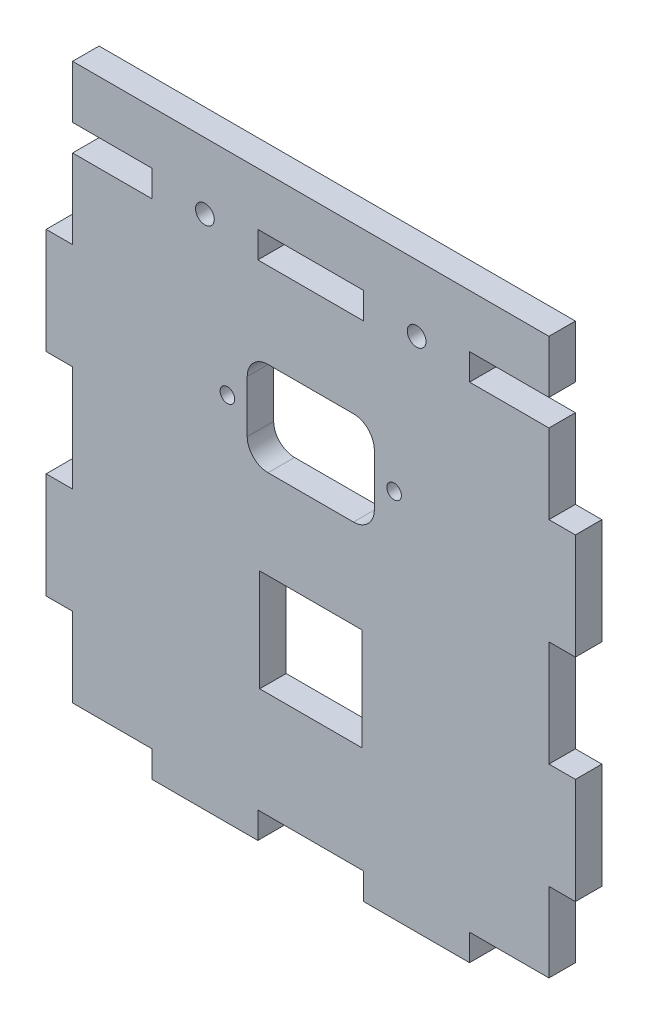
from build123d import *

# Parameters (mm, degrees)
SKETCH1_W                 = 127
SKETCH1_H                 = 139.7
BOSS_EXTRUDE1_DEPTH       = 6.35
SKETCH5_W                 = 6.35
SKETCH5_H                 = 25.4
CUT_EXTRUDE4_DEPTH        = 6.35
SKETCH6_W                 = 25.4
SKETCH6_H                 = 6.35
CUT_EXTRUDE5_DEPTH        = 6.35
LPATTERN5_COUNT           = 3
LPATTERN5_PITCH           = 50.8
LPATTERN5_COUNT_DIR2      = 2
LPATTERN5_PITCH_DIR2      = 120.65
LPATTERN6_COUNT           = 3
LPATTERN6_PITCH           = 50.8
LPATTERN6_COUNT_DIR2      = 2
LPATTERN6_PITCH_DIR2      = 120.65
SKETCH7_W                 = 6.35
SKETCH7_H                 = 19.05
SKETCH7_H_2               = 12.7
CUT_EXTRUDE6_DEPTH        = 6.35
F_8_CLEARANCE_HOLE1_D     = 4.4958
F_8_CLEARANCE_HOLE1_DEPTH = 10.16
F_8_CLEARANCE_HOLE1_TIP   = 1.350674586
SKETCH12_R                = 1.75
CUT_EXTRUDE9_DEPTH        = 6.35
SKETCH13_W                = 24.5
SKETCH13_H                = 24.5
CUT_EXTRUDE10_DEPTH       = 6.35


with BuildPart() as part:
    # Sketch1 → Boss-Extrude1 (new body)
    with BuildSketch(Plane.XY):
        with Locations((63.5, 69.85)):
            Rectangle(SKETCH1_W, SKETCH1_H)
    extrude(amount=BOSS_EXTRUDE1_DEPTH)

    # Sketch5 → Cut-Extrude4 (cut)
    with BuildSketch(Plane.XY.offset(6.35)):
        with Locations((3.175, 12.7)):
            Rectangle(SKETCH5_W, SKETCH5_H)
    cut_extrude4 = extrude(amount=-CUT_EXTRUDE4_DEPTH, mode=Mode.SUBTRACT)

    # Sketch6 → Cut-Extrude5 (cut)
    with BuildSketch(Plane.XY.offset(6.35)):
        with Locations((12.7, 3.175)):
            Rectangle(SKETCH6_W, SKETCH6_H)
    cut_extrude5 = extrude(amount=-CUT_EXTRUDE5_DEPTH, mode=Mode.SUBTRACT)

    # LPattern5: Cut-Extrude4 3 × 2
    with Locations(*[(j * LPATTERN5_PITCH_DIR2, i * LPATTERN5_PITCH, 0) for i in range(LPATTERN5_COUNT) for j in range(LPATTERN5_COUNT_DIR2) if (i, j) != (0, 0)]):
        add(cut_extrude4, mode=Mode.SUBTRACT)

    # LPattern6: Cut-Extrude5 3 × 2
    with Locations(*[(i * LPATTERN6_PITCH, j * LPATTERN6_PITCH_DIR2, 0) for i in range(LPATTERN6_COUNT) for j in range(LPATTERN6_COUNT_DIR2) if (i, j) != (0, 0)]):
        add(cut_extrude5, mode=Mode.SUBTRACT)

    # Sketch7 → Cut-Extrude6 (cut)
    with BuildSketch(Plane.XY.offset(6.35)):
        with Locations((3.175, 130.175)):
            Rectangle(SKETCH7_W, SKETCH7_H)
        with Locations((123.825, 133.35)):
            Rectangle(SKETCH7_W, SKETCH7_H_2)
    extrude(amount=-CUT_EXTRUDE6_DEPTH, mode=Mode.SUBTRACT)

    # #8 Clearance Hole1
    with Locations(Plane.XY.offset(6.35)):
        with Locations((38.1, 123.825), (88.9, 123.825)):
            Hole(F_8_CLEARANCE_HOLE1_D / 2, depth=F_8_CLEARANCE_HOLE1_DEPTH)
            with Locations((0, 0, -(F_8_CLEARANCE_HOLE1_DEPTH + F_8_CLEARANCE_HOLE1_TIP / 2))):  # 118° drill point
                Cone(0, F_8_CLEARANCE_HOLE1_D / 2, F_8_CLEARANCE_HOLE1_TIP, mode=Mode.SUBTRACT)

    # Sketch12 → Cut-Extrude9 (cut)
    with BuildSketch(Plane.XY.offset(6.35)):
        with Locations((43.5, 88.9)):
            Circle(SKETCH12_R)
        with Locations((83.5, 88.9)):
            Circle(SKETCH12_R)
        with BuildLine():
            Line((53.25, 100.15), (73.75, 100.15))
            ThreePointArc((73.75, 100.15), (77.285533906, 98.685533906), (78.75, 95.15))
            Line((78.75, 95.15), (78.75, 82.65))
            ThreePointArc((78.75, 82.65), (77.285533906, 79.114466094), (73.75, 77.65))
            Line((73.75, 77.65), (53.25, 77.65))
            ThreePointArc((53.25, 77.65), (49.714466094, 79.114466094), (48.25, 82.65))
            Line((48.25, 82.65), (48.25, 95.15))
            ThreePointArc((48.25, 95.15), (49.714466094, 98.685533906), (53.25, 100.15))
        make_face()
    extrude(amount=-CUT_EXTRUDE9_DEPTH, mode=Mode.SUBTRACT)

    # Sketch13 → Cut-Extrude10 (cut)
    with BuildSketch(Plane.XY.offset(6.35)):
        with Locations((63.5, 44)):
            Rectangle(SKETCH13_W, SKETCH13_H)
    extrude(amount=-CUT_EXTRUDE10_DEPTH, mode=Mode.SUBTRACT)


solid = part.part
